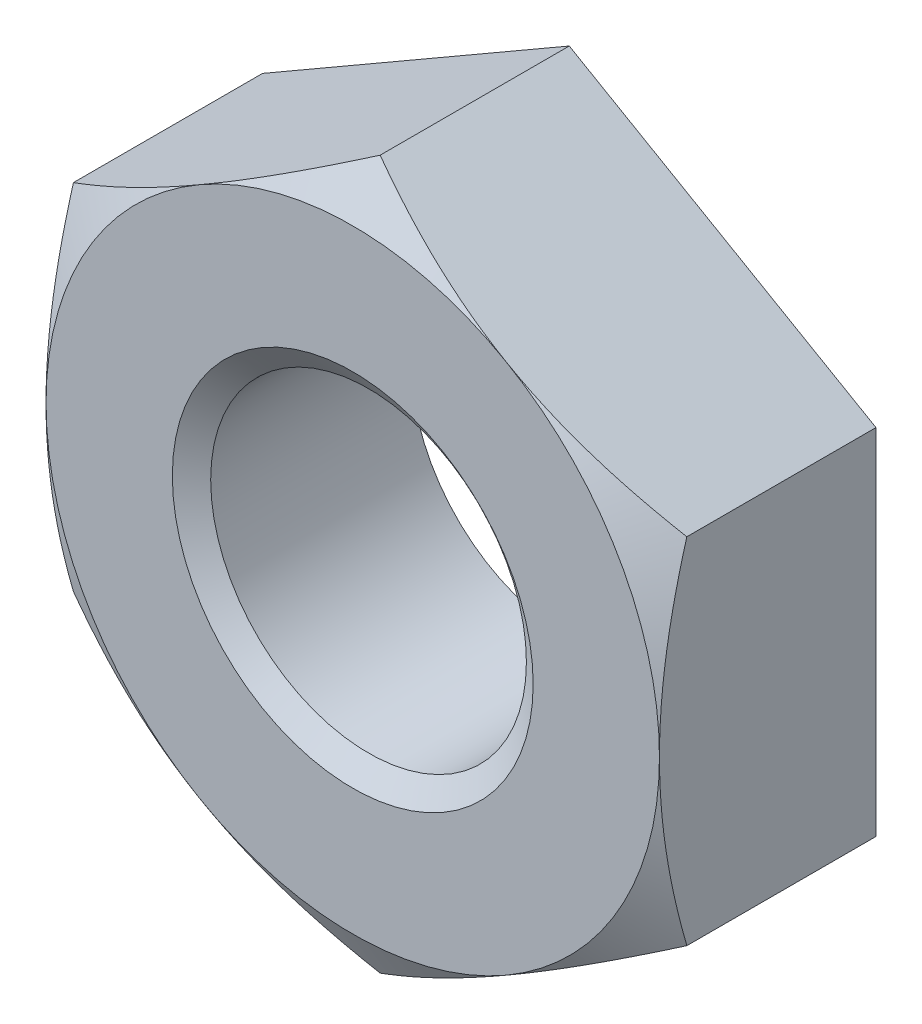
from build123d import *

# Parameters (mm, degrees)
BASENUT_START         = -18
BASENUTSKE_R          = 8.75
BASENUT_DEPTH         = 18
SKETCH4_W             = 0.8
SKETCH4_H             = 12.629909152
IZIM1_W               = 62.269157962
IZIM1_H               = 48.757925573
KES_EKSTR_ZYON1_DEPTH = 6


# Read off the part's stored shape, not the designer's step: ThreadSchematic
with BuildPart() as part:
    # BaseNutSke → BaseNut (new body)
    with BuildSketch(Plane.XY.offset(BASENUT_START)):
        Polygon((17, 9.814954576), (17, -9.814954576), (0, -19.629909152), (-17, -9.814954576), (-17, 9.814954576), (0, 19.629909152), align=None)
        Circle(BASENUTSKE_R, mode=Mode.SUBTRACT)
    extrude(amount=BASENUT_DEPTH)

    # Sketch5 (on Front Plane) → EndChamfer (revolve, cut)
    with BuildSketch(Plane.XY):
        Polygon((17.9746, 10), (17.011814635, 8.625), (18.0254, 8.625), (18.0254, 10), align=None)
    revolve(axis=Axis((17.9746, 10, 0), (-0.5735764363510453, -0.8191520442889925, 0)), mode=Mode.SUBTRACT)

    # Sketch4 → Bearing-Face (revolve, cut)
    with BuildSketch(Plane(origin=(0, 0, 0), x_dir=(0, 0, -1), z_dir=(1, 0, 0)), mode=Mode.PRIVATE) as bearing_face_sk:
        with Locations((17.6, 23.314954576)):
            Rectangle(SKETCH4_W, SKETCH4_H)
        Polygon((0, 17), (-10, 17), (-10, 29.629909152), (1.518378757, 29.629909152), (1.518378757, 19.629909152), align=None)
    revolve(bearing_face_sk.sketch.rotate(Axis((0, 0, 0), (0, 0, -1)), 270), axis=Axis((0, 0, 0), (0, 0, -1)), mode=Mode.SUBTRACT)

    # ThreadSchematic outline → ThreadSchematic (revolve, cut)
    with BuildSketch(Plane.XZ):
        Polygon((8.75, 0), (8.75, -0.875259423), (10, 0), align=None)
        Polygon((10, -17.9746), (8.75, -17.099340577), (8.75, -18), (10, -18), align=None)
    revolve(axis=Axis((0, 0, 0), (0, 0, 1)), mode=Mode.SUBTRACT)

    # Çizim1 → Kes-Ekstrüzyon1 (cut)
    with BuildSketch(Plane(origin=(0, 0, -18), x_dir=(-1, 0, 0), z_dir=(0, 0, -1))):
        with Locations((0.923127679, 2.056057103)):
            Rectangle(IZIM1_W, IZIM1_H)
    extrude(amount=-KES_EKSTR_ZYON1_DEPTH, mode=Mode.SUBTRACT)


solid = part.part
